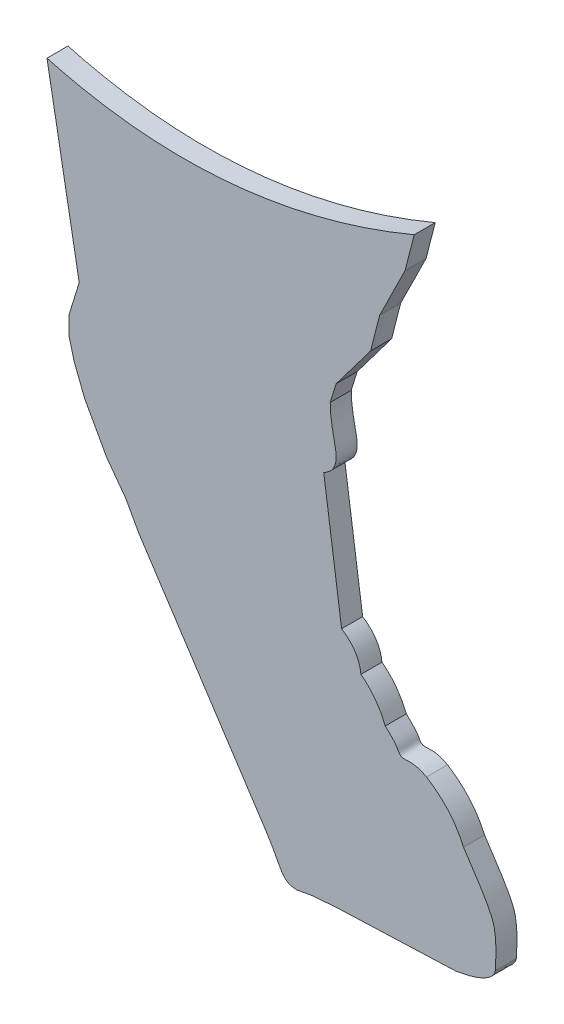
from build123d import *

# Parameters (mm, degrees)
BOSS_EXTRUDE2_DEPTH = 3.175


with BuildPart() as part:
    # Sketch1 → Boss-Extrude2 (new body)
    with BuildSketch(Plane.XY):
        with BuildLine():
            Line((95.015088918, 73.039622028), (93.442430116, 67.947203051))
            Line((93.442430116, 67.947203051), (93.442430116, 65.400993562))
            Line((93.442430116, 65.400993562), (94.228759517, 62.405452988))
            Line((94.228759517, 62.405452988), (95.838862576, 58.286584697))
            Line((95.838862576, 58.286584697), (97.860852464, 54.617047494))
            Line((97.860852464, 54.617047494), (99.187742953, 52.208986977))
            Line((99.187742953, 52.208986977), (102.054609268, 48.326412287))
            Line((102.054609268, 48.326412287), (104.044945002, 44.714321512))
            Line((104.044945002, 44.714321512), (123.032849585, 15.718572297))
            add(Edge.make_bspline(
                [(123.032849585, 15.718572297), (123.714332191, 14.723172575), (125.027867192, 12.417046111), (126.13133155, 9.993338557), (127.965130812, 10.093714094)],
                knots=[0, 0, 0, 0, 0.482545384, 1, 1, 1, 1], degree=3))
            Line((127.965130812, 10.093714094), (130.045906785, 10.470125175))
            Line((130.045906785, 10.470125175), (133.787640512, 10.774684897))
            Line((133.787640512, 10.774684897), (151.974206763, 11.470821404))
            add(Edge.make_bspline(
                [(157.829388483, 14.502166506), (157.371014603, 12.448651519), (153.413195637, 11.740221824), (151.974206763, 11.470821404)],
                knots=[0, 0, 0, 0, 1, 1, 1, 1], degree=3))
            add(Edge.make_bspline(
                [(153.017246456, 28.246281812), (155.053521845, 25.097258497), (156.168563434, 23.654410632), (158.146330261, 19.312087579), (157.900569474, 15.925786313), (157.829388483, 14.502166506)],
                knots=[0, 0, 0, 0, 0.545638179, 0.593853925, 1, 1, 1, 1], degree=3))
            add(Edge.make_bspline(
                [(147.437307536, 34.637439041), (151.311718476, 32.18181338), (153.017246456, 28.246281812)],
                knots=[0, 0, 0, 1, 1, 1], degree=2))
            add(Edge.make_bspline(
                [(141.208586267, 38.180201711), (142.057807777, 37.336444115), (142.696530206, 36.831682565), (143.864835089, 34.558137065), (144.807852022, 36.057345018), (147.437307536, 34.637439041)],
                knots=[0, 0, 0, 0, 0.387994133, 0.411004513, 1, 1, 1, 1], degree=3))
            add(Edge.make_bspline(
                [(137.536109778, 43.092261061), (139.98410163, 41.245320741), (141.208586267, 38.180201711)],
                knots=[0, 0, 0, 1, 1, 1], degree=2))
            add(Edge.make_bspline(
                [(134.617377974, 47.591397428), (137.229688432, 45.916641925), (137.536109778, 43.092261061)],
                knots=[0, 0, 0, 1, 1, 1], degree=2))
            Line((134.617377974, 47.591397428), (134.513357882, 48.326412287))
            Line((134.513357882, 48.326412287), (131.916773648, 66.674098307))
            add(Edge.make_bspline(
                [(132.897509942, 76.314808247), (132.915948654, 73.197862503), (134.383448092, 69.97548856), (133.38418012, 67.42441049), (131.916773648, 66.674098307)],
                knots=[0, 0, 0, 0, 0.57532368, 1, 1, 1, 1], degree=3))
            Line((132.897509942, 76.314808247), (133.787640512, 79.197135805))
            Line((133.787640512, 79.197135805), (138.995570312, 86.101639813))
            Line((138.995570312, 86.101639813), (140.361296403, 91.450733668))
            Line((140.361296403, 91.450733668), (143.122445567, 97.027448538))
            Line((143.122445567, 97.027448538), (144.200087546, 99.203970593))
            Line((144.200087546, 99.203970593), (145.570696028, 104.572187149))
            add(Edge.make_bspline(
                [(90.14826379, 99.94311483), (116.963000062, 92.578435943), (145.570696028, 104.572187149)],
                knots=[0, 0, 0, 1, 1, 1], degree=2))
            Line((90.14826379, 99.94311483), (92.499806905, 86.943937416))
            Line((92.499806905, 86.943937416), (95.015088918, 73.039622028))
        make_face()
    extrude(amount=BOSS_EXTRUDE2_DEPTH)


solid = part.part
